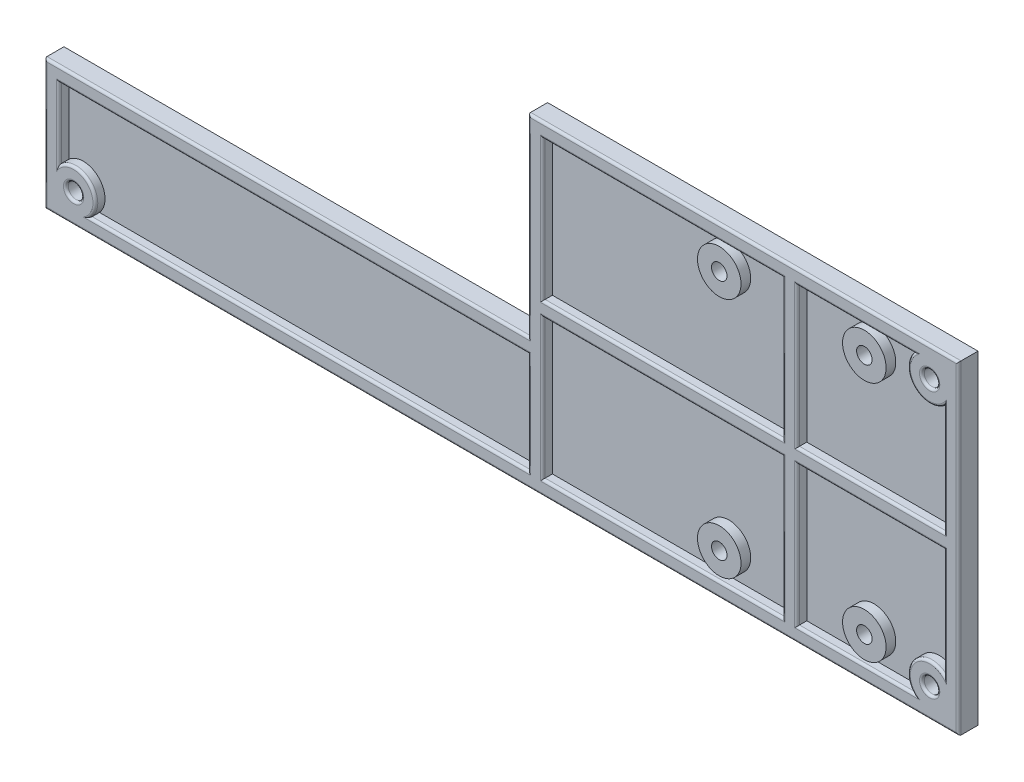
from build123d import *

# Parameters (mm, degrees)
ESQUISSE1_W             = 189
ESQUISSE1_H             = 67
ESQUISSE1_R             = 1.6
BOSS_EXTRU_1_DEPTH      = 2
ESQUISSE2_W             = 100
ESQUISSE2_H             = 40
ENL_V_MAT_EXTRU_1_DEPTH = 2
BOSS_EXTRU_2_DEPTH      = 2
ESQUISSE4_W             = 3
ESQUISSE4_H             = 27
ESQUISSE4_W_2           = 89
ESQUISSE4_H_2           = 3
BOSS_EXTRU_3_DEPTH      = 2
ESQUISSE5_W             = 3
ESQUISSE5_H             = 61
BOSS_EXTRU_4_DEPTH      = 2
ESQUISSE6_R             = 4.5
ESQUISSE6_R_2           = 1.6
BOSS_EXTRU_5_DEPTH      = 2
CONG_1_R                = 0.5


with BuildPart() as part:
    # Esquisse1 → Boss.-Extru.1 (new body)
    with BuildSketch(Plane.XY):
        Rectangle(ESQUISSE1_W, ESQUISSE1_H)
        with Locations((-88.5, -27.5)):
            Circle(ESQUISSE1_R, mode=Mode.SUBTRACT)
        with Locations((88.5, 27.5)):
            Circle(ESQUISSE1_R, mode=Mode.SUBTRACT)
        with Locations((88.5, -27.5)):
            Circle(ESQUISSE1_R, mode=Mode.SUBTRACT)
        with Locations((-88.5, 27.5)):
            Circle(ESQUISSE1_R, mode=Mode.SUBTRACT)
        with Locations((45, 25)):
            Circle(ESQUISSE1_R, mode=Mode.SUBTRACT)
        with Locations((75, 25)):
            Circle(ESQUISSE1_R, mode=Mode.SUBTRACT)
        with Locations((45, -25)):
            Circle(ESQUISSE1_R, mode=Mode.SUBTRACT)
        with Locations((75, -25)):
            Circle(ESQUISSE1_R, mode=Mode.SUBTRACT)
    extrude(amount=BOSS_EXTRU_1_DEPTH)

    # Esquisse2 → Enlèv. mat.-Extru.1 (cut)
    with BuildSketch(Plane.XY.offset(2)):
        with Locations((-44.5, 13.5)):
            Rectangle(ESQUISSE2_W, ESQUISSE2_H)
    extrude(amount=-ENL_V_MAT_EXTRU_1_DEPTH, mode=Mode.SUBTRACT)

    # Esquisse3 → Boss.-Extru.2 (add)
    with BuildSketch(Plane.XY.offset(2)):
        Polygon((94.5, 33.5), (5.5, 33.5), (5.5, -6.5), (-94.5, -6.5), (-94.5, -33.5), (94.5, -33.5), align=None)
        Polygon((91.5, 30.5), (8.5, 30.5), (8.5, -9.5), (-91.5, -9.5), (-91.5, -30.5), (91.5, -30.5), align=None, mode=Mode.SUBTRACT)
    extrude(amount=BOSS_EXTRU_2_DEPTH)

    # Esquisse4 → Boss.-Extru.3 (add)
    with BuildSketch(Plane.XY.offset(2)):
        with Locations((7, -20)):
            Rectangle(ESQUISSE4_W, ESQUISSE4_H)
        with Locations((50, 0)):
            Rectangle(ESQUISSE4_W_2, ESQUISSE4_H_2)
    extrude(amount=BOSS_EXTRU_3_DEPTH)

    # Esquisse5 → Boss.-Extru.4 (add)
    with BuildSketch(Plane.XY.offset(2)):
        with Locations((59.5991675, 0)):
            Rectangle(ESQUISSE5_W, ESQUISSE5_H)
    extrude(amount=BOSS_EXTRU_4_DEPTH)

    # Esquisse6 → Boss.-Extru.5 (add)
    # profile 1 of 7: a face of its own
    with BuildSketch(Plane.XY.offset(2)):
        with Locations((-88.5, -27.5)):
            Circle(ESQUISSE6_R)
        with Locations((-88.5, -27.5)):
            Circle(ESQUISSE6_R_2, mode=Mode.SUBTRACT)
    # profile 2 of 7: a face of its own
    with BuildSketch(Plane.XY.offset(2)):
        with Locations((88.5, -27.5)):
            Circle(ESQUISSE6_R)
        with Locations((88.5, -27.5)):
            Circle(ESQUISSE6_R_2, mode=Mode.SUBTRACT)
    # profile 3 of 7: a face of its own
    with BuildSketch(Plane.XY.offset(2)):
        with Locations((75, -25)):
            Circle(ESQUISSE6_R)
        with Locations((75, -25)):
            Circle(ESQUISSE6_R_2, mode=Mode.SUBTRACT)
    # profile 4 of 7: a face of its own
    with BuildSketch(Plane.XY.offset(2)):
        with Locations((45, -25)):
            Circle(ESQUISSE6_R)
        with Locations((45, -25)):
            Circle(ESQUISSE6_R_2, mode=Mode.SUBTRACT)
    # profile 5 of 7: a face of its own
    with BuildSketch(Plane.XY.offset(2)):
        with Locations((45, 25)):
            Circle(ESQUISSE6_R)
        with Locations((45, 25)):
            Circle(ESQUISSE6_R_2, mode=Mode.SUBTRACT)
    # profile 6 of 7: a face of its own
    with BuildSketch(Plane.XY.offset(2)):
        with Locations((75, 25)):
            Circle(ESQUISSE6_R)
        with Locations((75, 25)):
            Circle(ESQUISSE6_R_2, mode=Mode.SUBTRACT)
    # profile 7 of 7: a face of its own
    with BuildSketch(Plane.XY.offset(2)):
        with Locations((88.5, 27.5)):
            Circle(ESQUISSE6_R)
        with Locations((88.5, 27.5)):
            Circle(ESQUISSE6_R_2, mode=Mode.SUBTRACT)
    extrude(amount=BOSS_EXTRU_5_DEPTH)

    # Congé1
    cong_1_edges = [part.edges().sort_by_distance(p)[0] for p in [
        (86.9, 27.5, 4),
        (86.9, -27.5, 4),
        (-90.1, -27.5, 4),
        (50, 33.5, 4),
        (94.5, 0, 4),
        (0, -33.5, 4),
        (-94.5, -20, 4),
        (-44.5, -6.5, 4),
        (5.5, 13.5, 4),
        (33.29958375, -1.5, 4),
        (8.5, -16, 4),
        (33.29958375, -30.5, 4),
        (58.0991675, -16, 4),
        (76.29958375, -1.5, 4),
        (61.0991675, -16, 4),
        (73.122532767, -30.5, 4),
        (85.318019485, -24.318019485, 4),
        (91.5, -12.822949017, 4),
        (33.29958375, 30.5, 4),
        (8.5, 16, 4),
        (33.29958375, 1.5, 4),
        (58.0991675, 16, 4),
        (5.5, -20, 4),
        (-43, -9.5, 4),
        (-91.5, -16.822949017, 4),
        (-85.318019485, -24.318019485, 4),
        (-39.822949017, -30.5, 4),
        (61.0991675, 16, 4),
        (76.29958375, 1.5, 4),
        (91.5, 12.822949017, 4),
        (85.318019485, 24.318019485, 4),
        (73.122532767, 30.5, 4),
    ]]
    fillet(cong_1_edges, radius=CONG_1_R)


solid = part.part
